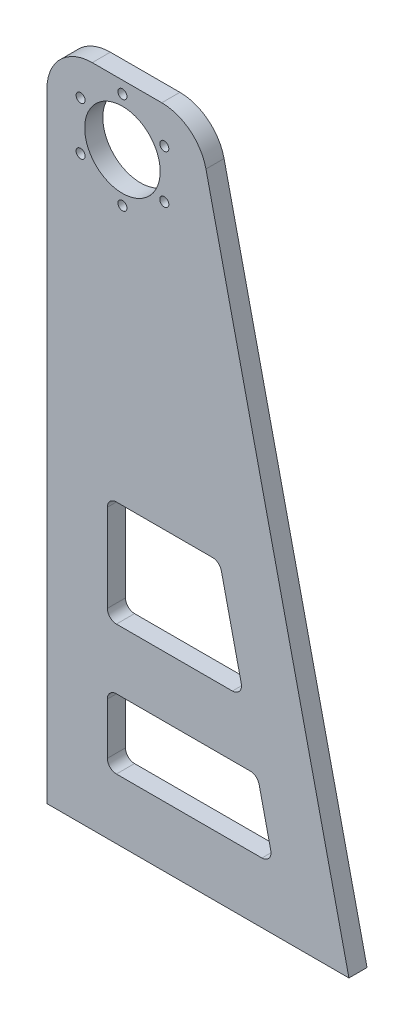
from build123d import *

# Parameters (mm, degrees)
ESBO_O1_R                = 12.5
ESBO_O1_R_2              = 1.5
RESSALTO_EXTRUS_O2_DEPTH = 6
FILETE1_R                = 15


with BuildPart() as part:
    # Esboço1 → Ressalto-extrusão2 (new body)
    with BuildSketch(Plane.XY):
        Polygon((0, 0), (0, 220), (50, 220), (100, 0), align=None)
        with Locations((25, 200)):
            Circle(ESBO_O1_R, mode=Mode.SUBTRACT)
        with Locations((25, 216)):
            Circle(ESBO_O1_R_2, mode=Mode.SUBTRACT)
        with Locations((38.856406461, 208)):
            Circle(ESBO_O1_R_2, mode=Mode.SUBTRACT)
        with Locations((38.856406461, 192)):
            Circle(ESBO_O1_R_2, mode=Mode.SUBTRACT)
        with Locations((25, 184)):
            Circle(ESBO_O1_R_2, mode=Mode.SUBTRACT)
        with Locations((11.143593539, 192)):
            Circle(ESBO_O1_R_2, mode=Mode.SUBTRACT)
        with Locations((11.143593539, 208)):
            Circle(ESBO_O1_R_2, mode=Mode.SUBTRACT)
        with BuildLine():
            Line((20, 95), (20, 66))
            ThreePointArc((20, 66), (20.878679656, 63.878679656), (23, 63))
            Line((23, 63), (61.413470366, 63))
            ThreePointArc((61.413470366, 63), (63.75810146, 64.128448496), (64.338868934, 66.664863311))
            Line((64.338868934, 66.664863311), (57.747959843, 95.664863311))
            ThreePointArc((57.747959843, 95.664863311), (56.69411278, 97.344631094), (54.822561275, 98))
            Line((54.822561275, 98), (23, 98))
            ThreePointArc((23, 98), (20.878679656, 97.121320344), (20, 95))
        make_face(mode=Mode.SUBTRACT)
        with BuildLine():
            Line((20, 40), (20, 23))
            ThreePointArc((20, 23), (20.878679656, 20.878679656), (23, 20))
            Line((23, 20), (71.186197639, 20))
            ThreePointArc((71.186197639, 20), (73.530828733, 21.128448496), (74.111596206, 23.664863311))
            Line((74.111596206, 23.664863311), (70.247959843, 40.664863311))
            ThreePointArc((70.247959843, 40.664863311), (69.19411278, 42.344631094), (67.322561275, 43))
            Line((67.322561275, 43), (23, 43))
            ThreePointArc((23, 43), (20.878679656, 42.121320344), (20, 40))
        make_face(mode=Mode.SUBTRACT)
    extrude(amount=RESSALTO_EXTRUS_O2_DEPTH)

    # Filete1
    filete1_edges = [part.edges().sort_by_distance(p)[0] for p in [
        (0, 220, 3),
        (50, 220, 3),
    ]]
    fillet(filete1_edges, radius=FILETE1_R)


solid = part.part
